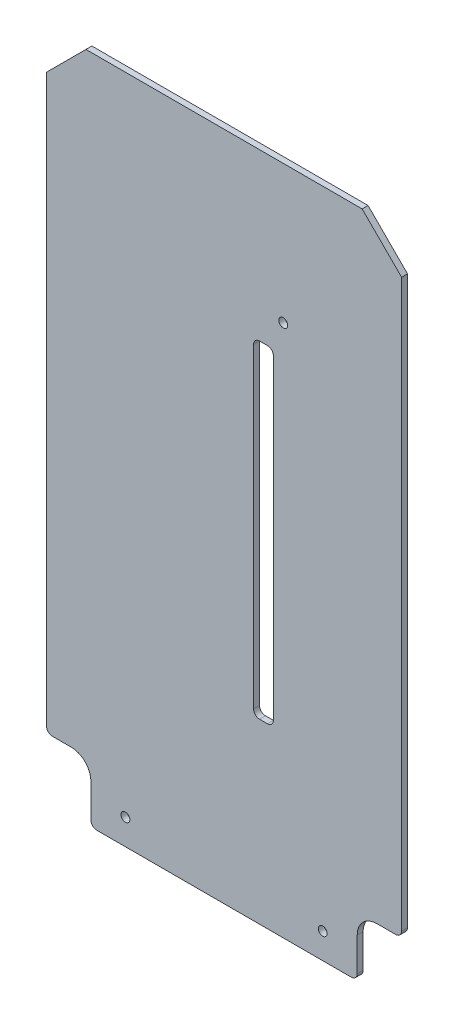
from build123d import *

# Parameters (mm, degrees)
ESQUISSE1_W                  = 180
ESQUISSE1_H                  = 340
BOSS_EXTRU_1_DEPTH           = 3
ENL_V_MAT_EXTRU_1_DEPTH      = 385.719378249
ENL_V_MAT_EXTRU_1_DEPTH_BACK = 385.719378249
ESQUISSE2_R                  = 2.25
ENL_V_MAT_EXTRU_2_DEPTH      = 385.719378249
ENL_V_MAT_EXTRU_2_DEPTH_BACK = 385.719378249
ESQUISSE3_W                  = 22.5
ESQUISSE3_H                  = 30
CONG_1_R                     = 10
CONG_2_R                     = 3
ENL_V_MAT_EXTRU_3_DEPTH      = 385.719378249
ENL_V_MAT_EXTRU_3_DEPTH_BACK = 385.719378249
ESQUISSE4_W                  = 10
ESQUISSE4_H                  = 166
CONG_3_R                     = 3
CHANFREIN1_SIZE              = 20
CHANFREIN2_SIZE              = 20
ESQUISSE5_R                  = 2.25
ENL_V_MAT_EXTRU_4_DEPTH      = 385.719378249


with BuildPart() as part:
    # Esquisse1 → Boss.-Extru.1 (new body)
    with BuildSketch(Plane.XY):
        with Locations((90, 170)):
            Rectangle(ESQUISSE1_W, ESQUISSE1_H)
    extrude(amount=BOSS_EXTRU_1_DEPTH)

    # Esquisse2 → Enlèv. mat.-Extru.1 (cut, two sides: drawn at the far end of the back side and taken through both)
    with BuildSketch(Plane.XY.offset(3).offset(-ENL_V_MAT_EXTRU_1_DEPTH_BACK)):
        with Locations((40, 13)):
            Circle(ESQUISSE2_R)
        with Locations((140, 13)):
            Circle(ESQUISSE2_R)
    extrude(amount=ENL_V_MAT_EXTRU_1_DEPTH + ENL_V_MAT_EXTRU_1_DEPTH_BACK, mode=Mode.SUBTRACT)

    # Esquisse3 → Enlèv. mat.-Extru.2 (cut, two sides: drawn at the far end of the back side and taken through both)
    with BuildSketch(Plane.XY.offset(3).offset(-ENL_V_MAT_EXTRU_2_DEPTH_BACK)):
        with Locations((11.25, 15)):
            Rectangle(ESQUISSE3_W, ESQUISSE3_H)
        with Locations((168.75, 15)):
            Rectangle(ESQUISSE3_W, ESQUISSE3_H)
    extrude(amount=ENL_V_MAT_EXTRU_2_DEPTH + ENL_V_MAT_EXTRU_2_DEPTH_BACK, mode=Mode.SUBTRACT)

    # Congé1
    cong_1_edges = [part.edges().sort_by_distance(p)[0] for p in [
        (157.5, 30, 1.5),
        (22.5, 30, 1.5),
    ]]
    fillet(cong_1_edges, radius=CONG_1_R)

    # Congé2
    cong_2_edges = [part.edges().sort_by_distance(p)[0] for p in [
        (0, 30, 1.5),
        (22.5, 0, 1.5),
        (180, 30, 1.5),
        (157.5, 0, 1.5),
    ]]
    fillet(cong_2_edges, radius=CONG_2_R)

    # Esquisse4 → Enlèv. mat.-Extru.3 (cut, two sides: drawn at the far end of the back side and taken through both)
    with BuildSketch(Plane.XY.offset(3).offset(-ENL_V_MAT_EXTRU_3_DEPTH_BACK)):
        with Locations((110, 173)):
            Rectangle(ESQUISSE4_W, ESQUISSE4_H)
    extrude(amount=ENL_V_MAT_EXTRU_3_DEPTH + ENL_V_MAT_EXTRU_3_DEPTH_BACK, mode=Mode.SUBTRACT)

    # Congé3
    cong_3_edges = [part.edges().sort_by_distance(p)[0] for p in [
        (105, 256, 1.5),
        (115, 256, 1.5),
        (115, 90, 1.5),
        (105, 90, 1.5),
    ]]
    fillet(cong_3_edges, radius=CONG_3_R)

    # Chanfrein1
    chanfrein1_edges = [part.edges().sort_by_distance(p)[0] for p in [
        (180, 340, 1.5),
    ]]
    chamfer(chanfrein1_edges, length=CHANFREIN1_SIZE)

    # Chanfrein2
    chanfrein2_edges = [part.edges().sort_by_distance(p)[0] for p in [
        (0, 340, 1.5),
    ]]
    chamfer(chanfrein2_edges, length=CHANFREIN2_SIZE)

    # Esquisse5 → Enlèv. mat.-Extru.4 (cut, through all)
    with BuildSketch(Plane.XY.offset(3)):
        with Locations((120, 270)):
            Circle(ESQUISSE5_R)
    extrude(amount=-ENL_V_MAT_EXTRU_4_DEPTH, mode=Mode.SUBTRACT)


solid = part.part
